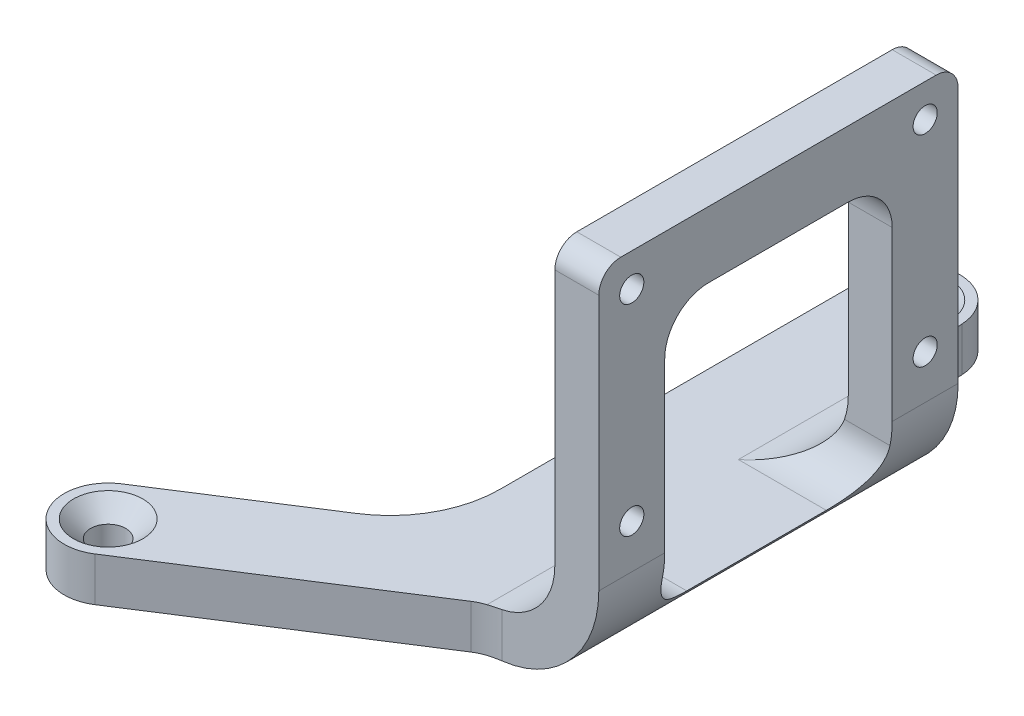
from build123d import *

# Parameters (mm, degrees)
BOSS_EXTRU_1_DEPTH                             = 62
FRAISAGE_POUR_VIS_T_TE_FRAIS_E_M31_D           = 3.2
FRAISAGE_POUR_VIS_T_TE_FRAIS_E_M31_CSINK_D     = 6.3
FRAISAGE_POUR_VIS_T_TE_FRAIS_E_M31_CSINK_ANGLE = 90
FRAISAGE_POUR_VIS_T_TE_FRAIS_E_M21_D           = 2.2
FRAISAGE_POUR_VIS_T_TE_FRAIS_E_M21_CSINK_D     = 4.4
FRAISAGE_POUR_VIS_T_TE_FRAIS_E_M21_CSINK_ANGLE = 90
ESQUISSE10_W                                   = 14.65
ESQUISSE10_H                                   = 31.3
ENL_V_MAT_EXTRU_1_DEPTH                        = 20
ENL_V_MAT_EXTRU_2_DEPTH                        = 20
CONG_1_R                                       = 2
CONG_2_R                                       = 4


with BuildPart() as part:
    # Esquisse1 → Boss.-Extru.1 (new body)
    with BuildSketch(Plane.XY):
        with BuildLine():
            Line((0, 35.3), (0, 10))
            ThreePointArc((0, 10), (-2.928932188, 2.928932188), (-10, 0))
            Line((-10, 0), (-38, 0))
            Line((-38, 0), (-38, 4))
            Line((-38, 4), (-10, 4))
            ThreePointArc((-10, 4), (-5.757359313, 5.757359313), (-4, 10))
            Line((-4, 10), (-4, 35.3))
            Line((-4, 35.3), (0, 35.3))
        make_face()
    extrude(amount=BOSS_EXTRU_1_DEPTH)

    # Fraisage pour vis à tête fraisée M31 (through all)
    with Locations(Plane(origin=(0, 4, 0), x_dir=(1, 0, 0), z_dir=(0, 1, 0))):
        with Locations((-34, -58), (-14.5, -4)):
            CounterSinkHole(FRAISAGE_POUR_VIS_T_TE_FRAIS_E_M31_D / 2, FRAISAGE_POUR_VIS_T_TE_FRAIS_E_M31_CSINK_D / 2, counter_sink_angle=FRAISAGE_POUR_VIS_T_TE_FRAIS_E_M31_CSINK_ANGLE)

    # Fraisage pour vis à tête fraisée M21 (through all)
    with Locations(Plane.ZY.offset(4)):
        with Locations((17.65, 32.29), (44.35, 14), (44.35, 32.29), (17.65, 14)):
            CounterSinkHole(FRAISAGE_POUR_VIS_T_TE_FRAIS_E_M21_D / 2, FRAISAGE_POUR_VIS_T_TE_FRAIS_E_M21_CSINK_D / 2, counter_sink_angle=FRAISAGE_POUR_VIS_T_TE_FRAIS_E_M21_CSINK_ANGLE)

    # Esquisse10 → Enlèv. mat.-Extru.1 (cut)
    with BuildSketch(Plane(origin=(0, 0, 0), x_dir=(0, 0, -1), z_dir=(1, 0, 0))):
        with Locations((-54.675, 19.65)):
            Rectangle(ESQUISSE10_W, ESQUISSE10_H)
        with Locations((-7.325, 19.65)):
            Rectangle(ESQUISSE10_W, ESQUISSE10_H)
        with BuildLine():
            Line((-37.35, 29.29), (-24.65, 29.29))
            ThreePointArc((-24.65, 29.29), (-21.821572875, 28.118427125), (-20.65, 25.29))
            Line((-20.65, 25.29), (-20.65, 8))
            ThreePointArc((-20.65, 8), (-21.821572875, 5.171572875), (-24.65, 4))
            Line((-24.65, 4), (-37.35, 4))
            ThreePointArc((-37.35, 4), (-40.178427125, 5.171572875), (-41.35, 8))
            Line((-41.35, 8), (-41.35, 25.29))
            ThreePointArc((-41.35, 25.29), (-40.178427125, 28.118427125), (-37.35, 29.29))
        make_face()
    extrude(amount=-ENL_V_MAT_EXTRU_1_DEPTH, mode=Mode.SUBTRACT)

    # Esquisse11 → Enlèv. mat.-Extru.2 (cut)
    with BuildSketch(Plane(origin=(0, 4, 0), x_dir=(1, 0, 0), z_dir=(0, 1, 0))):
        with BuildLine():
            ThreePointArc((-31.839515803, -61.366349363), (-32.874255236, -61.838319779), (-34, -62))
            Line((-34, -62), (-2, -62))
            Line((-2, -62), (-2, -47.35))
            Line((-2, -47.35), (-10, -47.35))
            Line((-10, -47.35), (-31.839515803, -61.366349363))
        make_face()
        with BuildLine():
            ThreePointArc((-34, -62), (-36.828427125, -60.828427125), (-38, -58))
            Line((-38, -58), (-38, -62))
            Line((-38, -62), (-34, -62))
        make_face()
        with BuildLine():
            Line((-2, 0), (-14.5, 0))
            ThreePointArc((-14.5, 0), (-11.738104222, -1.106570942), (-10.504325251, -3.814034144))
            Line((-10.504325251, -3.814034144), (-10, -14.65))
            Line((-10, -14.65), (-2, -14.65))
            Line((-2, -14.65), (-2, 0))
        make_face()
        with BuildLine():
            Line((-18.5, -37.83493222), (-18.5, -4))
            ThreePointArc((-18.5, -4), (-17.328427125, -1.171572875), (-14.5, 0))
            Line((-14.5, 0), (-38, 0))
            Line((-38, 0), (-38, -58))
            ThreePointArc((-38, -58), (-37.510123701, -56.081919812), (-36.160484197, -54.633650637))
            Line((-36.160484197, -54.633650637), (-23.098789508, -46.250805629))
            ThreePointArc((-23.098789508, -46.250805629), (-19.724690749, -42.63013269), (-18.5, -37.83493222))
        make_face()
    extrude(amount=-ENL_V_MAT_EXTRU_2_DEPTH, mode=Mode.SUBTRACT)

    # Congé1
    cong_1_edges = [part.edges().sort_by_distance(p)[0] for p in [
        (-2, 35.3, 47.35),
        (-2, 35.3, 14.65),
    ]]
    fillet(cong_1_edges, radius=CONG_1_R)

    # Congé2
    cong_2_edges = [part.edges().sort_by_distance(p)[0] for p in [
        (-10, 2, 14.65),
    ]]
    fillet(cong_2_edges, radius=CONG_2_R)
    cong_2_2_edges = [part.edges().sort_by_distance(p)[0] for p in [
        (-10, 2, 47.35),
    ]]
    fillet(cong_2_2_edges, radius=CONG_2_R)


solid = part.part
